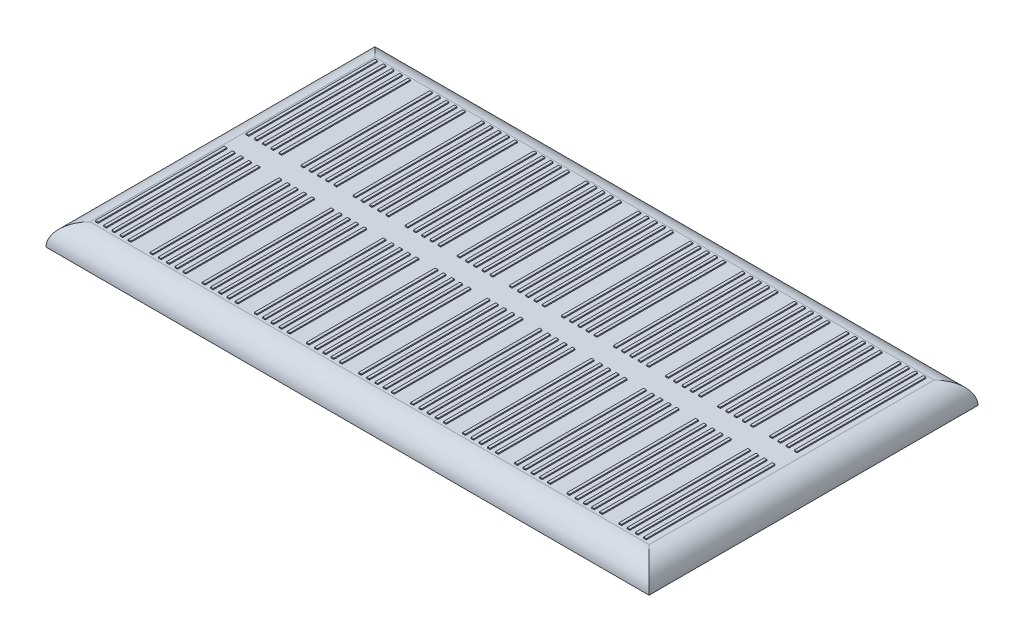
from build123d import *

# Parameters (mm, degrees)
SKETCH1_W                  = 110
SKETCH1_H                  = 60
BOSS_EXTRUDE1_DEPTH        = 4
FILLET1_R                  = 4
SKETCH2_W                  = 0.5
SKETCH2_H                  = 23.5
BOSS_EXTRUDE2_DEPTH        = 0.2
BOSS_EXTRUDE2_2_DEPTH      = 0.2
LPATTERN1_COUNT            = 5
LPATTERN1_PITCH            = 1.5
LPATTERN2_COUNT            = 2
LPATTERN2_PITCH            = 10
LPATTERN3_COPY_1_SKETCH_W  = 0.5
LPATTERN3_COPY_1_SKETCH_H  = 23.5
LPATTERN3_COPY_1_DEPTH     = 0.2
LPATTERN3_COPY_2_SKETCH_W  = 0.5
LPATTERN3_COPY_2_SKETCH_H  = 23.5
LPATTERN3_COPY_2_DEPTH     = 0.2
LPATTERN3_COPY_3_SKETCH_W  = 0.5
LPATTERN3_COPY_3_SKETCH_H  = 23.5
LPATTERN3_COPY_3_DEPTH     = 0.2
LPATTERN3_COPY_4_SKETCH_W  = 0.5
LPATTERN3_COPY_4_SKETCH_H  = 23.5
LPATTERN3_COPY_4_DEPTH     = 0.2
LPATTERN3_COPY_5_SKETCH_W  = 0.5
LPATTERN3_COPY_5_SKETCH_H  = 23.5
LPATTERN3_COPY_5_DEPTH     = 0.2
LPATTERN3_COPY_6_SKETCH_W  = 0.5
LPATTERN3_COPY_6_SKETCH_H  = 23.5
LPATTERN3_COPY_6_DEPTH     = 0.2
LPATTERN3_COPY_7_SKETCH_W  = 0.5
LPATTERN3_COPY_7_SKETCH_H  = 23.5
LPATTERN3_COPY_7_DEPTH     = 0.2
LPATTERN3_COPY_8_SKETCH_W  = 0.5
LPATTERN3_COPY_8_SKETCH_H  = 23.5
LPATTERN3_COPY_8_DEPTH     = 0.2
LPATTERN3_COPY_9_SKETCH_W  = 0.5
LPATTERN3_COPY_9_SKETCH_H  = 23.5
LPATTERN3_COPY_9_DEPTH     = 0.2
LPATTERN3_COPY_10_SKETCH_W = 0.5
LPATTERN3_COPY_10_SKETCH_H = 23.5
LPATTERN3_COPY_10_DEPTH    = 0.2
LPATTERN3_COPY_11_SKETCH_W = 0.5
LPATTERN3_COPY_11_SKETCH_H = 23.5
LPATTERN3_COPY_11_DEPTH    = 0.2
LPATTERN3_COPY_12_SKETCH_W = 0.5
LPATTERN3_COPY_12_SKETCH_H = 23.5
LPATTERN3_COPY_12_DEPTH    = 0.2
LPATTERN3_COPY_13_SKETCH_W = 0.5
LPATTERN3_COPY_13_SKETCH_H = 23.5
LPATTERN3_COPY_13_DEPTH    = 0.2
LPATTERN3_COPY_14_SKETCH_W = 0.5
LPATTERN3_COPY_14_SKETCH_H = 23.5
LPATTERN3_COPY_14_DEPTH    = 0.2
LPATTERN3_COPY_15_SKETCH_W = 0.5
LPATTERN3_COPY_15_SKETCH_H = 23.5
LPATTERN3_COPY_15_DEPTH    = 0.2
LPATTERN3_COPY_16_SKETCH_W = 0.5
LPATTERN3_COPY_16_SKETCH_H = 23.5
LPATTERN3_COPY_16_DEPTH    = 0.2
LPATTERN4_START            = -55.5
LPATTERN4_OUTLINE_W        = 0.5
LPATTERN4_OUTLINE_H        = 0.2
LPATTERN4_DEPTH            = 23.5
LPATTERN4_START_2          = -28
LPATTERN4_2_OUTLINE_W      = 0.5
LPATTERN4_2_OUTLINE_H      = 0.2
LPATTERN4_2_DEPTH          = 23.5


# Read off the part's stored shape, not the designer's step: LPattern4
with BuildPart() as part:
    # Sketch1 → Boss-Extrude1 (new body)
    with BuildSketch(Plane(origin=(0, 0, 0), x_dir=(1, 0, 0), z_dir=(0, 1, 0))):
        with Locations((55, 30)):
            Rectangle(SKETCH1_W, SKETCH1_H)
    extrude(amount=BOSS_EXTRUDE1_DEPTH)

    # Fillet1
    fillet1_edges = [part.edges().sort_by_distance(p)[0] for p in [
        (0, 4, -30),
        (55, 4, -60),
        (110, 4, -30),
        (55, 4, 0),
    ]]
    fillet(fillet1_edges, radius=FILLET1_R - 0.0001)  # a hair under: the kernel refuses the full size


with BuildPart() as body_2:
    # Sketch2 → Boss-Extrude2 (new body)
    with BuildSketch(Plane(origin=(0, 4, 0), x_dir=(1, 0, 0), z_dir=(0, 1, 0))):
        with Locations((4.75, 43.75)):
            Rectangle(SKETCH2_W, SKETCH2_H)
    boss_extrude2 = extrude(amount=BOSS_EXTRUDE2_DEPTH)


with BuildPart() as body_3:
    # Sketch2 → Boss-Extrude2 2 (new body)
    with BuildSketch(Plane(origin=(0, 4, 0), x_dir=(1, 0, 0), z_dir=(0, 1, 0))):
        with Locations((4.75, 16.25)):
            Rectangle(SKETCH2_W, SKETCH2_H)
    boss_extrude2_2 = extrude(amount=BOSS_EXTRUDE2_2_DEPTH)


with BuildPart() as part_1:
    add(part.part)

    # LPattern1: Boss-Extrude2, Boss-Extrude2 2 ×5
    with Locations(*[(i * LPATTERN1_PITCH, 0, 0) for i in range(1, LPATTERN1_COUNT)]):
        add(boss_extrude2)
        add(boss_extrude2_2)

    # LPattern2: Boss-Extrude2, Boss-Extrude2 2 ×2
    with Locations(*[(i * LPATTERN2_PITCH, 0, 0) for i in range(1, LPATTERN2_COUNT)]):
        add(boss_extrude2)
        add(boss_extrude2_2)

    # LPattern3 copy 1 sketch → LPattern3 copy 1 (add)
    with BuildSketch(Plane(origin=(11.5, 4, 0), x_dir=(1, 0, 0), z_dir=(0, 1, 0))):
        with Locations((4.75, 43.75)):
            Rectangle(LPATTERN3_COPY_1_SKETCH_W, LPATTERN3_COPY_1_SKETCH_H)
    extrude(amount=LPATTERN3_COPY_1_DEPTH)

    # LPattern3 copy 2 sketch → LPattern3 copy 2 (add)
    with BuildSketch(Plane(origin=(13, 4, 0), x_dir=(1, 0, 0), z_dir=(0, 1, 0))):
        with Locations((4.75, 43.75)):
            Rectangle(LPATTERN3_COPY_2_SKETCH_W, LPATTERN3_COPY_2_SKETCH_H)
    extrude(amount=LPATTERN3_COPY_2_DEPTH)

    # LPattern3 copy 3 sketch → LPattern3 copy 3 (add)
    with BuildSketch(Plane(origin=(14.5, 4, 0), x_dir=(1, 0, 0), z_dir=(0, 1, 0))):
        with Locations((4.75, 43.75)):
            Rectangle(LPATTERN3_COPY_3_SKETCH_W, LPATTERN3_COPY_3_SKETCH_H)
    extrude(amount=LPATTERN3_COPY_3_DEPTH)

    # LPattern3 copy 4 sketch → LPattern3 copy 4 (add)
    with BuildSketch(Plane(origin=(16, 4, 0), x_dir=(1, 0, 0), z_dir=(0, 1, 0))):
        with Locations((4.75, 43.75)):
            Rectangle(LPATTERN3_COPY_4_SKETCH_W, LPATTERN3_COPY_4_SKETCH_H)
    extrude(amount=LPATTERN3_COPY_4_DEPTH)

    # LPattern3 copy 5 sketch → LPattern3 copy 5 (add)
    with BuildSketch(Plane(origin=(11.5, 4, 0), x_dir=(1, 0, 0), z_dir=(0, 1, 0))):
        with Locations((4.75, 16.25)):
            Rectangle(LPATTERN3_COPY_5_SKETCH_W, LPATTERN3_COPY_5_SKETCH_H)
    extrude(amount=LPATTERN3_COPY_5_DEPTH)

    # LPattern3 copy 6 sketch → LPattern3 copy 6 (add)
    with BuildSketch(Plane(origin=(13, 4, 0), x_dir=(1, 0, 0), z_dir=(0, 1, 0))):
        with Locations((4.75, 16.25)):
            Rectangle(LPATTERN3_COPY_6_SKETCH_W, LPATTERN3_COPY_6_SKETCH_H)
    extrude(amount=LPATTERN3_COPY_6_DEPTH)

    # LPattern3 copy 7 sketch → LPattern3 copy 7 (add)
    with BuildSketch(Plane(origin=(14.5, 4, 0), x_dir=(1, 0, 0), z_dir=(0, 1, 0))):
        with Locations((4.75, 16.25)):
            Rectangle(LPATTERN3_COPY_7_SKETCH_W, LPATTERN3_COPY_7_SKETCH_H)
    extrude(amount=LPATTERN3_COPY_7_DEPTH)

    # LPattern3 copy 8 sketch → LPattern3 copy 8 (add)
    with BuildSketch(Plane(origin=(16, 4, 0), x_dir=(1, 0, 0), z_dir=(0, 1, 0))):
        with Locations((4.75, 16.25)):
            Rectangle(LPATTERN3_COPY_8_SKETCH_W, LPATTERN3_COPY_8_SKETCH_H)
    extrude(amount=LPATTERN3_COPY_8_DEPTH)

    # LPattern3 copy 9 sketch → LPattern3 copy 9 (add)
    with BuildSketch(Plane(origin=(1.5, 4, 0), x_dir=(1, 0, 0), z_dir=(0, 1, 0))):
        with Locations((4.75, 43.75)):
            Rectangle(LPATTERN3_COPY_9_SKETCH_W, LPATTERN3_COPY_9_SKETCH_H)
    extrude(amount=LPATTERN3_COPY_9_DEPTH)

    # LPattern3 copy 10 sketch → LPattern3 copy 10 (add)
    with BuildSketch(Plane(origin=(3, 4, 0), x_dir=(1, 0, 0), z_dir=(0, 1, 0))):
        with Locations((4.75, 43.75)):
            Rectangle(LPATTERN3_COPY_10_SKETCH_W, LPATTERN3_COPY_10_SKETCH_H)
    extrude(amount=LPATTERN3_COPY_10_DEPTH)

    # LPattern3 copy 11 sketch → LPattern3 copy 11 (add)
    with BuildSketch(Plane(origin=(4.5, 4, 0), x_dir=(1, 0, 0), z_dir=(0, 1, 0))):
        with Locations((4.75, 43.75)):
            Rectangle(LPATTERN3_COPY_11_SKETCH_W, LPATTERN3_COPY_11_SKETCH_H)
    extrude(amount=LPATTERN3_COPY_11_DEPTH)

    # LPattern3 copy 12 sketch → LPattern3 copy 12 (add)
    with BuildSketch(Plane(origin=(6, 4, 0), x_dir=(1, 0, 0), z_dir=(0, 1, 0))):
        with Locations((4.75, 43.75)):
            Rectangle(LPATTERN3_COPY_12_SKETCH_W, LPATTERN3_COPY_12_SKETCH_H)
    extrude(amount=LPATTERN3_COPY_12_DEPTH)

    # LPattern3 copy 13 sketch → LPattern3 copy 13 (add)
    with BuildSketch(Plane(origin=(1.5, 4, 0), x_dir=(1, 0, 0), z_dir=(0, 1, 0))):
        with Locations((4.75, 16.25)):
            Rectangle(LPATTERN3_COPY_13_SKETCH_W, LPATTERN3_COPY_13_SKETCH_H)
    extrude(amount=LPATTERN3_COPY_13_DEPTH)

    # LPattern3 copy 14 sketch → LPattern3 copy 14 (add)
    with BuildSketch(Plane(origin=(3, 4, 0), x_dir=(1, 0, 0), z_dir=(0, 1, 0))):
        with Locations((4.75, 16.25)):
            Rectangle(LPATTERN3_COPY_14_SKETCH_W, LPATTERN3_COPY_14_SKETCH_H)
    extrude(amount=LPATTERN3_COPY_14_DEPTH)

    # LPattern3 copy 15 sketch → LPattern3 copy 15 (add)
    with BuildSketch(Plane(origin=(4.5, 4, 0), x_dir=(1, 0, 0), z_dir=(0, 1, 0))):
        with Locations((4.75, 16.25)):
            Rectangle(LPATTERN3_COPY_15_SKETCH_W, LPATTERN3_COPY_15_SKETCH_H)
    extrude(amount=LPATTERN3_COPY_15_DEPTH)

    # LPattern3 copy 16 sketch → LPattern3 copy 16 (add)
    with BuildSketch(Plane(origin=(6, 4, 0), x_dir=(1, 0, 0), z_dir=(0, 1, 0))):
        with Locations((4.75, 16.25)):
            Rectangle(LPATTERN3_COPY_16_SKETCH_W, LPATTERN3_COPY_16_SKETCH_H)
    extrude(amount=LPATTERN3_COPY_16_DEPTH)

    # LPattern4 outline → LPattern4 (add)
    with BuildSketch(Plane.XY.offset(LPATTERN4_START)):
        with Locations((30.25, 4.1)):
            Rectangle(LPATTERN4_OUTLINE_W, LPATTERN4_OUTLINE_H)
        with Locations((104.75, 4.1)):
            Rectangle(LPATTERN4_OUTLINE_W, LPATTERN4_OUTLINE_H)
        with Locations((103.25, 4.1)):
            Rectangle(LPATTERN4_OUTLINE_W, LPATTERN4_OUTLINE_H)
        with Locations((101.75, 4.1)):
            Rectangle(LPATTERN4_OUTLINE_W, LPATTERN4_OUTLINE_H)
        with Locations((100.25, 4.1)):
            Rectangle(LPATTERN4_OUTLINE_W, LPATTERN4_OUTLINE_H)
        with Locations((96.75, 4.1)):
            Rectangle(LPATTERN4_OUTLINE_W, LPATTERN4_OUTLINE_H)
        with Locations((95.25, 4.1)):
            Rectangle(LPATTERN4_OUTLINE_W, LPATTERN4_OUTLINE_H)
        with Locations((93.75, 4.1)):
            Rectangle(LPATTERN4_OUTLINE_W, LPATTERN4_OUTLINE_H)
        with Locations((92.25, 4.1)):
            Rectangle(LPATTERN4_OUTLINE_W, LPATTERN4_OUTLINE_H)
        with Locations((90.75, 4.1)):
            Rectangle(LPATTERN4_OUTLINE_W, LPATTERN4_OUTLINE_H)
        with Locations((87.25, 4.1)):
            Rectangle(LPATTERN4_OUTLINE_W, LPATTERN4_OUTLINE_H)
        with Locations((85.75, 4.1)):
            Rectangle(LPATTERN4_OUTLINE_W, LPATTERN4_OUTLINE_H)
        with Locations((84.25, 4.1)):
            Rectangle(LPATTERN4_OUTLINE_W, LPATTERN4_OUTLINE_H)
        with Locations((82.75, 4.1)):
            Rectangle(LPATTERN4_OUTLINE_W, LPATTERN4_OUTLINE_H)
        with Locations((81.25, 4.1)):
            Rectangle(LPATTERN4_OUTLINE_W, LPATTERN4_OUTLINE_H)
        with Locations((77.75, 4.1)):
            Rectangle(LPATTERN4_OUTLINE_W, LPATTERN4_OUTLINE_H)
        with Locations((76.25, 4.1)):
            Rectangle(LPATTERN4_OUTLINE_W, LPATTERN4_OUTLINE_H)
        with Locations((74.75, 4.1)):
            Rectangle(LPATTERN4_OUTLINE_W, LPATTERN4_OUTLINE_H)
        with Locations((73.25, 4.1)):
            Rectangle(LPATTERN4_OUTLINE_W, LPATTERN4_OUTLINE_H)
        with Locations((71.75, 4.1)):
            Rectangle(LPATTERN4_OUTLINE_W, LPATTERN4_OUTLINE_H)
        with Locations((68.25, 4.1)):
            Rectangle(LPATTERN4_OUTLINE_W, LPATTERN4_OUTLINE_H)
        with Locations((66.75, 4.1)):
            Rectangle(LPATTERN4_OUTLINE_W, LPATTERN4_OUTLINE_H)
        with Locations((65.25, 4.1)):
            Rectangle(LPATTERN4_OUTLINE_W, LPATTERN4_OUTLINE_H)
        with Locations((63.75, 4.1)):
            Rectangle(LPATTERN4_OUTLINE_W, LPATTERN4_OUTLINE_H)
        with Locations((62.25, 4.1)):
            Rectangle(LPATTERN4_OUTLINE_W, LPATTERN4_OUTLINE_H)
        with Locations((58.75, 4.1)):
            Rectangle(LPATTERN4_OUTLINE_W, LPATTERN4_OUTLINE_H)
        with Locations((57.25, 4.1)):
            Rectangle(LPATTERN4_OUTLINE_W, LPATTERN4_OUTLINE_H)
        with Locations((55.75, 4.1)):
            Rectangle(LPATTERN4_OUTLINE_W, LPATTERN4_OUTLINE_H)
        with Locations((54.25, 4.1)):
            Rectangle(LPATTERN4_OUTLINE_W, LPATTERN4_OUTLINE_H)
        with Locations((52.75, 4.1)):
            Rectangle(LPATTERN4_OUTLINE_W, LPATTERN4_OUTLINE_H)
        with Locations((49.25, 4.1)):
            Rectangle(LPATTERN4_OUTLINE_W, LPATTERN4_OUTLINE_H)
        with Locations((47.75, 4.1)):
            Rectangle(LPATTERN4_OUTLINE_W, LPATTERN4_OUTLINE_H)
        with Locations((46.25, 4.1)):
            Rectangle(LPATTERN4_OUTLINE_W, LPATTERN4_OUTLINE_H)
        with Locations((44.75, 4.1)):
            Rectangle(LPATTERN4_OUTLINE_W, LPATTERN4_OUTLINE_H)
        with Locations((43.25, 4.1)):
            Rectangle(LPATTERN4_OUTLINE_W, LPATTERN4_OUTLINE_H)
        with Locations((39.75, 4.1)):
            Rectangle(LPATTERN4_OUTLINE_W, LPATTERN4_OUTLINE_H)
        with Locations((38.25, 4.1)):
            Rectangle(LPATTERN4_OUTLINE_W, LPATTERN4_OUTLINE_H)
        with Locations((36.75, 4.1)):
            Rectangle(LPATTERN4_OUTLINE_W, LPATTERN4_OUTLINE_H)
        with Locations((35.25, 4.1)):
            Rectangle(LPATTERN4_OUTLINE_W, LPATTERN4_OUTLINE_H)
        with Locations((33.75, 4.1)):
            Rectangle(LPATTERN4_OUTLINE_W, LPATTERN4_OUTLINE_H)
        with Locations((24.25, 4.1)):
            Rectangle(LPATTERN4_OUTLINE_W, LPATTERN4_OUTLINE_H)
        with Locations((25.75, 4.1)):
            Rectangle(LPATTERN4_OUTLINE_W, LPATTERN4_OUTLINE_H)
        with Locations((27.25, 4.1)):
            Rectangle(LPATTERN4_OUTLINE_W, LPATTERN4_OUTLINE_H)
        with Locations((28.75, 4.1)):
            Rectangle(LPATTERN4_OUTLINE_W, LPATTERN4_OUTLINE_H)
    extrude(amount=LPATTERN4_DEPTH)

    # LPattern4 2 outline → LPattern4 2 (add)
    with BuildSketch(Plane.XY.offset(LPATTERN4_START_2)):
        with Locations((30.25, 4.1)):
            Rectangle(LPATTERN4_2_OUTLINE_W, LPATTERN4_2_OUTLINE_H)
        with Locations((104.75, 4.1)):
            Rectangle(LPATTERN4_2_OUTLINE_W, LPATTERN4_2_OUTLINE_H)
        with Locations((103.25, 4.1)):
            Rectangle(LPATTERN4_2_OUTLINE_W, LPATTERN4_2_OUTLINE_H)
        with Locations((101.75, 4.1)):
            Rectangle(LPATTERN4_2_OUTLINE_W, LPATTERN4_2_OUTLINE_H)
        with Locations((100.25, 4.1)):
            Rectangle(LPATTERN4_2_OUTLINE_W, LPATTERN4_2_OUTLINE_H)
        with Locations((96.75, 4.1)):
            Rectangle(LPATTERN4_2_OUTLINE_W, LPATTERN4_2_OUTLINE_H)
        with Locations((95.25, 4.1)):
            Rectangle(LPATTERN4_2_OUTLINE_W, LPATTERN4_2_OUTLINE_H)
        with Locations((93.75, 4.1)):
            Rectangle(LPATTERN4_2_OUTLINE_W, LPATTERN4_2_OUTLINE_H)
        with Locations((92.25, 4.1)):
            Rectangle(LPATTERN4_2_OUTLINE_W, LPATTERN4_2_OUTLINE_H)
        with Locations((90.75, 4.1)):
            Rectangle(LPATTERN4_2_OUTLINE_W, LPATTERN4_2_OUTLINE_H)
        with Locations((87.25, 4.1)):
            Rectangle(LPATTERN4_2_OUTLINE_W, LPATTERN4_2_OUTLINE_H)
        with Locations((85.75, 4.1)):
            Rectangle(LPATTERN4_2_OUTLINE_W, LPATTERN4_2_OUTLINE_H)
        with Locations((84.25, 4.1)):
            Rectangle(LPATTERN4_2_OUTLINE_W, LPATTERN4_2_OUTLINE_H)
        with Locations((82.75, 4.1)):
            Rectangle(LPATTERN4_2_OUTLINE_W, LPATTERN4_2_OUTLINE_H)
        with Locations((81.25, 4.1)):
            Rectangle(LPATTERN4_2_OUTLINE_W, LPATTERN4_2_OUTLINE_H)
        with Locations((77.75, 4.1)):
            Rectangle(LPATTERN4_2_OUTLINE_W, LPATTERN4_2_OUTLINE_H)
        with Locations((76.25, 4.1)):
            Rectangle(LPATTERN4_2_OUTLINE_W, LPATTERN4_2_OUTLINE_H)
        with Locations((74.75, 4.1)):
            Rectangle(LPATTERN4_2_OUTLINE_W, LPATTERN4_2_OUTLINE_H)
        with Locations((73.25, 4.1)):
            Rectangle(LPATTERN4_2_OUTLINE_W, LPATTERN4_2_OUTLINE_H)
        with Locations((71.75, 4.1)):
            Rectangle(LPATTERN4_2_OUTLINE_W, LPATTERN4_2_OUTLINE_H)
        with Locations((68.25, 4.1)):
            Rectangle(LPATTERN4_2_OUTLINE_W, LPATTERN4_2_OUTLINE_H)
        with Locations((66.75, 4.1)):
            Rectangle(LPATTERN4_2_OUTLINE_W, LPATTERN4_2_OUTLINE_H)
        with Locations((65.25, 4.1)):
            Rectangle(LPATTERN4_2_OUTLINE_W, LPATTERN4_2_OUTLINE_H)
        with Locations((63.75, 4.1)):
            Rectangle(LPATTERN4_2_OUTLINE_W, LPATTERN4_2_OUTLINE_H)
        with Locations((62.25, 4.1)):
            Rectangle(LPATTERN4_2_OUTLINE_W, LPATTERN4_2_OUTLINE_H)
        with Locations((58.75, 4.1)):
            Rectangle(LPATTERN4_2_OUTLINE_W, LPATTERN4_2_OUTLINE_H)
        with Locations((57.25, 4.1)):
            Rectangle(LPATTERN4_2_OUTLINE_W, LPATTERN4_2_OUTLINE_H)
        with Locations((55.75, 4.1)):
            Rectangle(LPATTERN4_2_OUTLINE_W, LPATTERN4_2_OUTLINE_H)
        with Locations((54.25, 4.1)):
            Rectangle(LPATTERN4_2_OUTLINE_W, LPATTERN4_2_OUTLINE_H)
        with Locations((52.75, 4.1)):
            Rectangle(LPATTERN4_2_OUTLINE_W, LPATTERN4_2_OUTLINE_H)
        with Locations((49.25, 4.1)):
            Rectangle(LPATTERN4_2_OUTLINE_W, LPATTERN4_2_OUTLINE_H)
        with Locations((47.75, 4.1)):
            Rectangle(LPATTERN4_2_OUTLINE_W, LPATTERN4_2_OUTLINE_H)
        with Locations((46.25, 4.1)):
            Rectangle(LPATTERN4_2_OUTLINE_W, LPATTERN4_2_OUTLINE_H)
        with Locations((44.75, 4.1)):
            Rectangle(LPATTERN4_2_OUTLINE_W, LPATTERN4_2_OUTLINE_H)
        with Locations((43.25, 4.1)):
            Rectangle(LPATTERN4_2_OUTLINE_W, LPATTERN4_2_OUTLINE_H)
        with Locations((39.75, 4.1)):
            Rectangle(LPATTERN4_2_OUTLINE_W, LPATTERN4_2_OUTLINE_H)
        with Locations((38.25, 4.1)):
            Rectangle(LPATTERN4_2_OUTLINE_W, LPATTERN4_2_OUTLINE_H)
        with Locations((36.75, 4.1)):
            Rectangle(LPATTERN4_2_OUTLINE_W, LPATTERN4_2_OUTLINE_H)
        with Locations((35.25, 4.1)):
            Rectangle(LPATTERN4_2_OUTLINE_W, LPATTERN4_2_OUTLINE_H)
        with Locations((33.75, 4.1)):
            Rectangle(LPATTERN4_2_OUTLINE_W, LPATTERN4_2_OUTLINE_H)
        with Locations((24.25, 4.1)):
            Rectangle(LPATTERN4_2_OUTLINE_W, LPATTERN4_2_OUTLINE_H)
        with Locations((25.75, 4.1)):
            Rectangle(LPATTERN4_2_OUTLINE_W, LPATTERN4_2_OUTLINE_H)
        with Locations((27.25, 4.1)):
            Rectangle(LPATTERN4_2_OUTLINE_W, LPATTERN4_2_OUTLINE_H)
        with Locations((28.75, 4.1)):
            Rectangle(LPATTERN4_2_OUTLINE_W, LPATTERN4_2_OUTLINE_H)
    extrude(amount=LPATTERN4_2_DEPTH)


solid = Compound([body_2.part, body_3.part, part_1.part])
